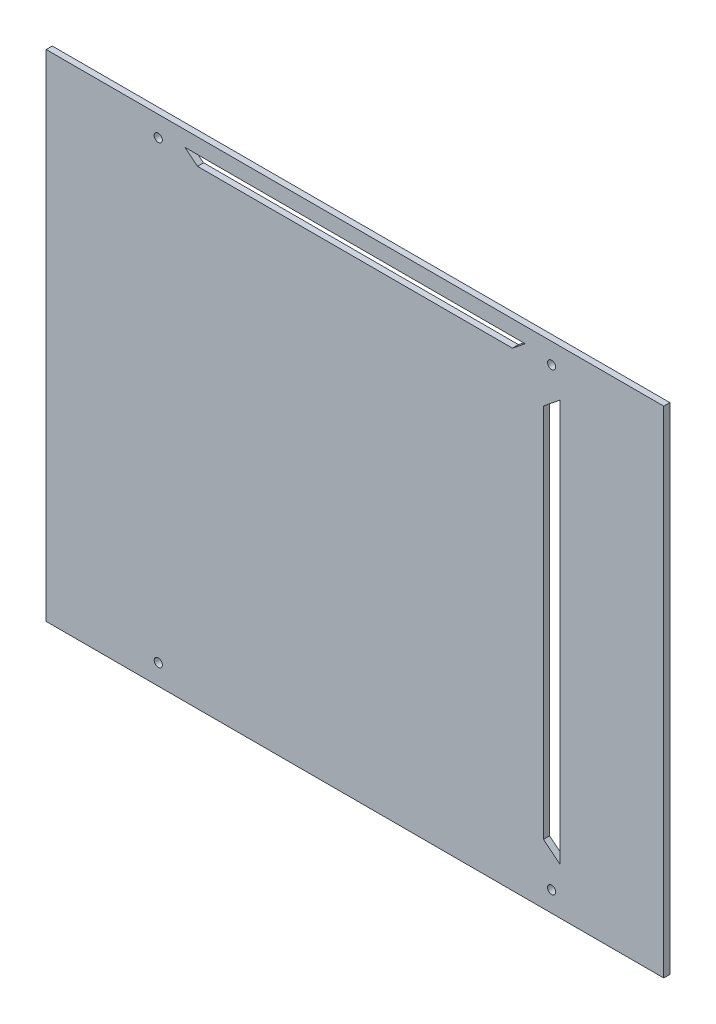
from build123d import *

# Parameters (mm, degrees)
SKETCH1_W           = 303
SKETCH1_H           = 243
SKETCH1_R           = 2
BOSS_EXTRUDE1_DEPTH = 3


with BuildPart() as part:
    # Sketch1 → Boss-Extrude1 (new body)
    with BuildSketch(Plane.XY):
        Rectangle(SKETCH1_W, SKETCH1_H)
        with Locations((-96.5, 111.5)):
            Circle(SKETCH1_R, mode=Mode.SUBTRACT)
        with Locations((96.5, 111.5)):
            Circle(SKETCH1_R, mode=Mode.SUBTRACT)
        with Locations((96.5, -111.5)):
            Circle(SKETCH1_R, mode=Mode.SUBTRACT)
        with Locations((-96.5, -111.5)):
            Circle(SKETCH1_R, mode=Mode.SUBTRACT)
        Polygon((100.5, 98.5), (100.5, -98.5), (92.5, -92.084158416), (92.5, 92.084158416), align=None, mode=Mode.SUBTRACT)
        Polygon((83.5, 114), (-83.5, 114), (-77.265432099, 109), (77.265432099, 109), align=None, mode=Mode.SUBTRACT)
    extrude(amount=BOSS_EXTRUDE1_DEPTH)


solid = part.part
